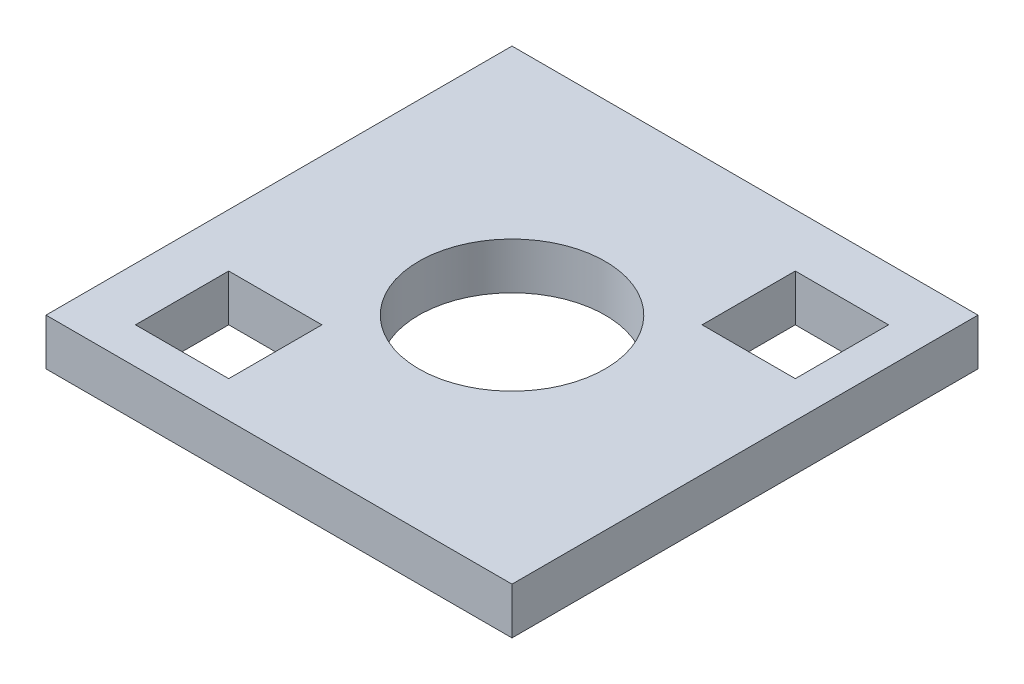
from build123d import *

# Parameters (mm, degrees)
SKETCH2_W           = 100
SKETCH2_H           = 100
SKETCH2_R           = 20
BOSS_EXTRUDE3_DEPTH = 10
SKETCH4_W           = 20
SKETCH4_H           = 20
CUT_EXTRUDE1_DEPTH  = 10


with BuildPart() as part:
    # Sketch2 → Boss-Extrude3 (new body)
    with BuildSketch(Plane(origin=(0, 0, 0), x_dir=(1, 0, 0), z_dir=(0, 1, 0))):
        Rectangle(SKETCH2_W, SKETCH2_H)
        Circle(SKETCH2_R, mode=Mode.SUBTRACT)
    extrude(amount=BOSS_EXTRUDE3_DEPTH)

    # Sketch4 → Cut-Extrude1 (cut)
    with BuildSketch(Plane(origin=(0, 10, 0), x_dir=(1, 0, 0), z_dir=(0, 1, 0))):
        with Locations((-28.587347761, -32.204911614)):
            Rectangle(SKETCH4_W, SKETCH4_H)
        with Locations((32.204911614, 28.587347761)):
            Rectangle(SKETCH4_W, SKETCH4_H)
    extrude(amount=-CUT_EXTRUDE1_DEPTH, mode=Mode.SUBTRACT)


solid = part.part
